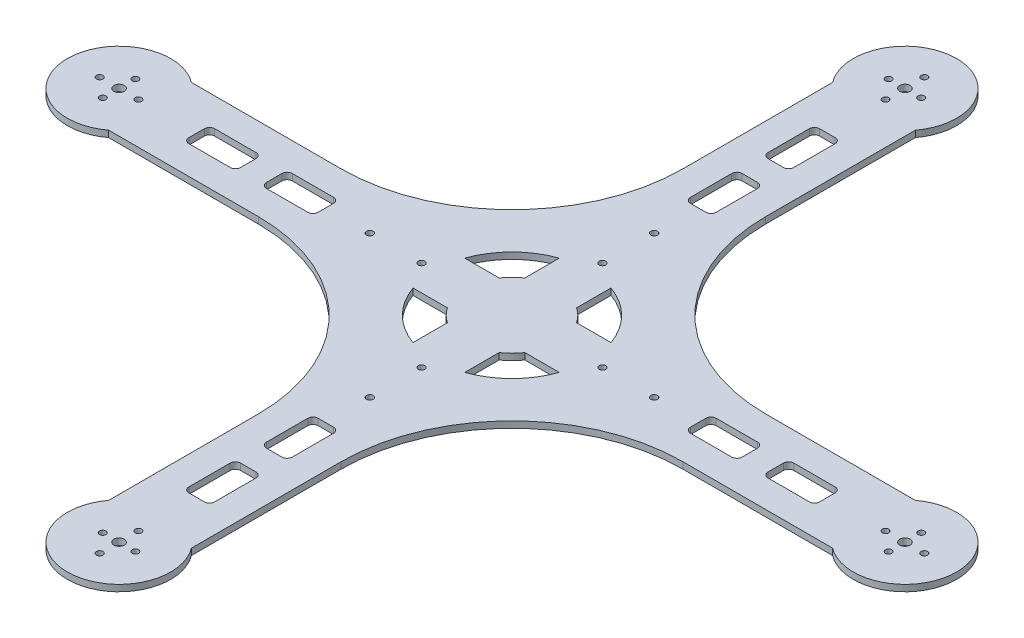
from build123d import *

# Parameters (mm, degrees)
SKETCH1_R           = 1.5875
SKETCH1_R_2         = 2.54
BOSS_EXTRUDE1_DEPTH = 3.175
CUT_EXTRUDE1_REACH  = 504.938
SKETCH5_R           = 1.651


with BuildPart() as part:
    # Sketch1 → Boss-Extrude1 (new body)
    with BuildSketch(Plane(origin=(0, 0, 0), x_dir=(1, 0, 0), z_dir=(0, 1, 0))):
        with BuildLine():
            Line((129.095821507, 17.784127356), (55.54156313, 17.784127356))
            ThreePointArc((55.54156313, 17.784127356), (14.90156313, -2.535872644), (55.54156313, -22.855872644))
            Line((55.54156313, -22.855872644), (129.095821507, -22.855872644))
            ThreePointArc((129.095821507, -22.855872644), (188.440282525, -47.437153249), (213.02156313, -106.781614267))
            Line((213.02156313, -106.781614267), (213.02156313, -180.335872644))
            ThreePointArc((213.02156313, -180.335872644), (233.34156313, -220.975872644), (253.66156313, -180.335872644))
            Line((253.66156313, -180.335872644), (253.66156313, -106.781614267))
            ThreePointArc((253.66156313, -106.781614267), (278.242843735, -47.437153249), (337.587304753, -22.855872644))
            Line((337.587304753, -22.855872644), (411.14156313, -22.855872644))
            ThreePointArc((411.14156313, -22.855872644), (451.78156313, -2.535872644), (411.14156313, 17.784127356))
            Line((411.14156313, 17.784127356), (337.587304753, 17.784127356))
            ThreePointArc((337.587304753, 17.784127356), (278.242843735, 42.365407962), (253.66156313, 101.70986898))
            Line((253.66156313, 101.70986898), (253.66156313, 175.264127356))
            ThreePointArc((253.66156313, 175.264127356), (233.34156313, 215.904127356), (213.02156313, 175.264127356))
            Line((213.02156313, 175.264127356), (213.02156313, 101.70986898))
            ThreePointArc((213.02156313, 101.70986898), (188.440282525, 42.365407962), (129.095821507, 17.784127356))
        make_face()
        with BuildLine():
            ThreePointArc((78.40156313, 1.274127356), (79.145511906, 3.07017858), (80.94156313, 3.814127356))
            Line((80.94156313, 3.814127356), (101.26156313, 3.814127356))
            ThreePointArc((101.26156313, 3.814127356), (103.057614354, 3.07017858), (103.80156313, 1.274127356))
            Line((103.80156313, 1.274127356), (103.80156313, -6.345872644))
            ThreePointArc((103.80156313, -6.345872644), (103.057614354, -8.141923868), (101.26156313, -8.885872644))
            Line((101.26156313, -8.885872644), (80.94156313, -8.885872644))
            ThreePointArc((80.94156313, -8.885872644), (79.145511906, -8.141923868), (78.40156313, -6.345872644))
            Line((78.40156313, -6.345872644), (78.40156313, 1.274127356))
        make_face(mode=Mode.SUBTRACT)
        with BuildLine():
            ThreePointArc((116.50156313, 1.274127356), (117.245511906, 3.07017858), (119.04156313, 3.814127356))
            Line((119.04156313, 3.814127356), (139.36156313, 3.814127356))
            ThreePointArc((139.36156313, 3.814127356), (141.157614354, 3.07017858), (141.90156313, 1.274127356))
            Line((141.90156313, 1.274127356), (141.90156313, -6.345872644))
            ThreePointArc((141.90156313, -6.345872644), (141.157614354, -8.141923868), (139.36156313, -8.885872644))
            Line((139.36156313, -8.885872644), (119.04156313, -8.885872644))
            ThreePointArc((119.04156313, -8.885872644), (117.245511906, -8.141923868), (116.50156313, -6.345872644))
            Line((116.50156313, -6.345872644), (116.50156313, 1.274127356))
        make_face(mode=Mode.SUBTRACT)
        with Locations((40.30156313, 5.464127356)):
            Circle(SKETCH1_R, mode=Mode.SUBTRACT)
        with Locations((49.80156313, -2.535872644)):
            Circle(SKETCH1_R, mode=Mode.SUBTRACT)
        with Locations((40.30156313, -10.535872644)):
            Circle(SKETCH1_R, mode=Mode.SUBTRACT)
        with Locations((30.80156313, -2.535872644)):
            Circle(SKETCH1_R, mode=Mode.SUBTRACT)
        with Locations((40.30156313, -2.535872644)):
            Circle(SKETCH1_R_2, mode=Mode.SUBTRACT)
        with BuildLine():
            ThreePointArc((220.64156313, -38.456897128), (206.400794767, -29.476641007), (197.420538646, -15.235872644))
            Line((197.420538646, -15.235872644), (214.333943605, -15.235872644))
            ThreePointArc((214.333943605, -15.235872644), (217.177102112, -18.700333662), (220.64156313, -21.543492169))
            Line((220.64156313, -21.543492169), (220.64156313, -38.456897128))
        make_face(mode=Mode.SUBTRACT)
        with BuildLine():
            ThreePointArc((269.262587614, -15.235872644), (260.282331493, -29.476641007), (246.04156313, -38.456897128))
            Line((246.04156313, -38.456897128), (246.04156313, -21.543492169))
            ThreePointArc((246.04156313, -21.543492169), (249.506024148, -18.700333662), (252.349182655, -15.235872644))
            Line((252.349182655, -15.235872644), (269.262587614, -15.235872644))
        make_face(mode=Mode.SUBTRACT)
        with BuildLine():
            ThreePointArc((246.04156313, 33.385151841), (260.282331493, 24.404895719), (269.262587614, 10.164127356))
            Line((269.262587614, 10.164127356), (252.349182655, 10.164127356))
            ThreePointArc((252.349182655, 10.164127356), (249.506024148, 13.628588374), (246.04156313, 16.471746881))
            Line((246.04156313, 16.471746881), (246.04156313, 33.385151841))
        make_face(mode=Mode.SUBTRACT)
        with BuildLine():
            ThreePointArc((197.420538646, 10.164127356), (206.400794767, 24.404895719), (220.64156313, 33.385151841))
            Line((220.64156313, 33.385151841), (220.64156313, 16.471746881))
            ThreePointArc((220.64156313, 16.471746881), (217.177102112, 13.628588374), (214.333943605, 10.164127356))
            Line((214.333943605, 10.164127356), (197.420538646, 10.164127356))
        make_face(mode=Mode.SUBTRACT)
        with BuildLine():
            Line((226.99156313, 129.544127356), (226.99156313, 149.864127356))
            ThreePointArc((226.99156313, 149.864127356), (227.735511906, 151.66017858), (229.53156313, 152.404127356))
            Line((229.53156313, 152.404127356), (237.15156313, 152.404127356))
            ThreePointArc((237.15156313, 152.404127356), (238.947614354, 151.66017858), (239.69156313, 149.864127356))
            Line((239.69156313, 149.864127356), (239.69156313, 129.544127356))
            ThreePointArc((239.69156313, 129.544127356), (238.947614354, 127.748076132), (237.15156313, 127.004127356))
            Line((237.15156313, 127.004127356), (229.53156313, 127.004127356))
            ThreePointArc((229.53156313, 127.004127356), (227.735511906, 127.748076132), (226.99156313, 129.544127356))
        make_face(mode=Mode.SUBTRACT)
        with BuildLine():
            ThreePointArc((226.99156313, 111.764127356), (227.735511906, 113.56017858), (229.53156313, 114.304127356))
            Line((229.53156313, 114.304127356), (237.15156313, 114.304127356))
            ThreePointArc((237.15156313, 114.304127356), (238.947614354, 113.56017858), (239.69156313, 111.764127356))
            Line((239.69156313, 111.764127356), (239.69156313, 91.444127356))
            ThreePointArc((239.69156313, 91.444127356), (238.947614354, 89.648076132), (237.15156313, 88.904127356))
            Line((237.15156313, 88.904127356), (229.53156313, 88.904127356))
            ThreePointArc((229.53156313, 88.904127356), (227.735511906, 89.648076132), (226.99156313, 91.444127356))
            Line((226.99156313, 91.444127356), (226.99156313, 111.764127356))
        make_face(mode=Mode.SUBTRACT)
        with BuildLine():
            ThreePointArc((365.42156313, -8.885872644), (363.625511906, -8.141923868), (362.88156313, -6.345872644))
            Line((362.88156313, -6.345872644), (362.88156313, 1.274127356))
            ThreePointArc((362.88156313, 1.274127356), (363.625511906, 3.07017858), (365.42156313, 3.814127356))
            Line((365.42156313, 3.814127356), (385.74156313, 3.814127356))
            ThreePointArc((385.74156313, 3.814127356), (387.537614354, 3.07017858), (388.28156313, 1.274127356))
            Line((388.28156313, 1.274127356), (388.28156313, -6.345872644))
            ThreePointArc((388.28156313, -6.345872644), (387.537614354, -8.141923868), (385.74156313, -8.885872644))
            Line((385.74156313, -8.885872644), (365.42156313, -8.885872644))
        make_face(mode=Mode.SUBTRACT)
        with BuildLine():
            ThreePointArc((350.18156313, -6.345872644), (349.437614354, -8.141923868), (347.64156313, -8.885872644))
            Line((347.64156313, -8.885872644), (327.32156313, -8.885872644))
            ThreePointArc((327.32156313, -8.885872644), (325.525511906, -8.141923868), (324.78156313, -6.345872644))
            Line((324.78156313, -6.345872644), (324.78156313, 1.274127356))
            ThreePointArc((324.78156313, 1.274127356), (325.525511906, 3.07017858), (327.32156313, 3.814127356))
            Line((327.32156313, 3.814127356), (347.64156313, 3.814127356))
            ThreePointArc((347.64156313, 3.814127356), (349.437614354, 3.07017858), (350.18156313, 1.274127356))
            Line((350.18156313, 1.274127356), (350.18156313, -6.345872644))
        make_face(mode=Mode.SUBTRACT)
        with BuildLine():
            Line((237.15156313, -119.375872644), (229.53156313, -119.375872644))
            ThreePointArc((229.53156313, -119.375872644), (227.735511906, -118.631923868), (226.99156313, -116.835872644))
            Line((226.99156313, -116.835872644), (226.99156313, -96.515872644))
            ThreePointArc((226.99156313, -96.515872644), (227.735511906, -94.71982142), (229.53156313, -93.975872644))
            Line((229.53156313, -93.975872644), (237.15156313, -93.975872644))
            ThreePointArc((237.15156313, -93.975872644), (238.947614354, -94.71982142), (239.69156313, -96.515872644))
            Line((239.69156313, -96.515872644), (239.69156313, -116.835872644))
            ThreePointArc((239.69156313, -116.835872644), (238.947614354, -118.631923868), (237.15156313, -119.375872644))
        make_face(mode=Mode.SUBTRACT)
        with BuildLine():
            Line((229.53156313, -132.075872644), (237.15156313, -132.075872644))
            ThreePointArc((237.15156313, -132.075872644), (238.947614354, -132.81982142), (239.69156313, -134.615872644))
            Line((239.69156313, -134.615872644), (239.69156313, -154.935872644))
            ThreePointArc((239.69156313, -154.935872644), (238.947614354, -156.731923868), (237.15156313, -157.475872644))
            Line((237.15156313, -157.475872644), (229.53156313, -157.475872644))
            ThreePointArc((229.53156313, -157.475872644), (227.735511906, -156.731923868), (226.99156313, -154.935872644))
            Line((226.99156313, -154.935872644), (226.99156313, -134.615872644))
            ThreePointArc((226.99156313, -134.615872644), (227.735511906, -132.81982142), (229.53156313, -132.075872644))
        make_face(mode=Mode.SUBTRACT)
        with Locations((241.34156313, 190.504127356)):
            Circle(SKETCH1_R, mode=Mode.SUBTRACT)
        with Locations((225.34156313, 190.504127356)):
            Circle(SKETCH1_R, mode=Mode.SUBTRACT)
        with Locations((233.34156313, 200.004127356)):
            Circle(SKETCH1_R, mode=Mode.SUBTRACT)
        with Locations((233.34156313, 181.004127356)):
            Circle(SKETCH1_R, mode=Mode.SUBTRACT)
        with Locations((233.34156313, 190.504127356)):
            Circle(SKETCH1_R_2, mode=Mode.SUBTRACT)
        with Locations((426.38156313, 5.464127356)):
            Circle(SKETCH1_R, mode=Mode.SUBTRACT)
        with Locations((426.38156313, -10.535872644)):
            Circle(SKETCH1_R, mode=Mode.SUBTRACT)
        with Locations((416.88156313, -2.535872644)):
            Circle(SKETCH1_R, mode=Mode.SUBTRACT)
        with Locations((426.38156313, -2.535872644)):
            Circle(SKETCH1_R_2, mode=Mode.SUBTRACT)
        with Locations((435.88156313, -2.535872644)):
            Circle(SKETCH1_R, mode=Mode.SUBTRACT)
        with Locations((233.34156313, -186.075872644)):
            Circle(SKETCH1_R, mode=Mode.SUBTRACT)
        with Locations((225.34156313, -195.575872644)):
            Circle(SKETCH1_R, mode=Mode.SUBTRACT)
        with Locations((233.34156313, -205.075872644)):
            Circle(SKETCH1_R, mode=Mode.SUBTRACT)
        with Locations((233.34156313, -195.575872644)):
            Circle(SKETCH1_R_2, mode=Mode.SUBTRACT)
        with Locations((241.34156313, -195.575872644)):
            Circle(SKETCH1_R, mode=Mode.SUBTRACT)
    extrude(amount=BOSS_EXTRUDE1_DEPTH)

    # Sketch5 → Cut-Extrude1 (cut, up to next)
    with BuildSketch(Plane.XZ, mode=Mode.PRIVATE) as cut_extrude1_sk1:
        with Locations((233.34156313, 46.985872644)):
            Circle(SKETCH5_R)
    cut_extrude1_tool1 = extrude(cut_extrude1_sk1.sketch, amount=-CUT_EXTRUDE1_REACH, mode=Mode.PRIVATE) & part.part
    # Sketch5 → Cut-Extrude1 (cut, up to next)
    with BuildSketch(Plane.XZ, mode=Mode.PRIVATE) as cut_extrude1_sk2:
        with Locations((233.34156313, 72.385872644)):
            Circle(SKETCH5_R)
    cut_extrude1_tool2 = extrude(cut_extrude1_sk2.sketch, amount=-CUT_EXTRUDE1_REACH, mode=Mode.PRIVATE) & part.part
    # Sketch5 → Cut-Extrude1 (cut, up to next)
    with BuildSketch(Plane.XZ, mode=Mode.PRIVATE) as cut_extrude1_sk3:
        with Locations((277.79156313, 2.535872644)):
            Circle(SKETCH5_R)
    cut_extrude1_tool3 = extrude(cut_extrude1_sk3.sketch, amount=-CUT_EXTRUDE1_REACH, mode=Mode.PRIVATE) & part.part
    # Sketch5 → Cut-Extrude1 (cut, up to next)
    with BuildSketch(Plane.XZ, mode=Mode.PRIVATE) as cut_extrude1_sk4:
        with Locations((303.19156313, 2.535872644)):
            Circle(SKETCH5_R)
    cut_extrude1_tool4 = extrude(cut_extrude1_sk4.sketch, amount=-CUT_EXTRUDE1_REACH, mode=Mode.PRIVATE) & part.part
    # Sketch5 → Cut-Extrude1 (cut, up to next)
    with BuildSketch(Plane.XZ, mode=Mode.PRIVATE) as cut_extrude1_sk5:
        with Locations((233.34156313, -41.914127356)):
            Circle(SKETCH5_R)
    cut_extrude1_tool5 = extrude(cut_extrude1_sk5.sketch, amount=-CUT_EXTRUDE1_REACH, mode=Mode.PRIVATE) & part.part
    # Sketch5 → Cut-Extrude1 (cut, up to next)
    with BuildSketch(Plane.XZ, mode=Mode.PRIVATE) as cut_extrude1_sk6:
        with Locations((233.34156313, -67.314127356)):
            Circle(SKETCH5_R)
    cut_extrude1_tool6 = extrude(cut_extrude1_sk6.sketch, amount=-CUT_EXTRUDE1_REACH, mode=Mode.PRIVATE) & part.part
    # Sketch5 → Cut-Extrude1 (cut, up to next)
    with BuildSketch(Plane.XZ, mode=Mode.PRIVATE) as cut_extrude1_sk7:
        with Locations((163.49156313, 2.535872644)):
            Circle(SKETCH5_R)
    cut_extrude1_tool7 = extrude(cut_extrude1_sk7.sketch, amount=-CUT_EXTRUDE1_REACH, mode=Mode.PRIVATE) & part.part
    # Sketch5 → Cut-Extrude1 (cut, up to next)
    with BuildSketch(Plane.XZ, mode=Mode.PRIVATE) as cut_extrude1_sk8:
        with Locations((188.89156313, 2.535872644)):
            Circle(SKETCH5_R)
    cut_extrude1_tool8 = extrude(cut_extrude1_sk8.sketch, amount=-CUT_EXTRUDE1_REACH, mode=Mode.PRIVATE) & part.part
    add(cut_extrude1_tool1.solids().sort_by_distance((233.341563, 0, 46.985873))[0], mode=Mode.SUBTRACT)
    add(cut_extrude1_tool2.solids().sort_by_distance((233.341563, 0, 72.385873))[0], mode=Mode.SUBTRACT)
    add(cut_extrude1_tool3.solids().sort_by_distance((277.791563, 0, 2.535873))[0], mode=Mode.SUBTRACT)
    add(cut_extrude1_tool4.solids().sort_by_distance((303.191563, 0, 2.535873))[0], mode=Mode.SUBTRACT)
    add(cut_extrude1_tool5.solids().sort_by_distance((233.341563, 0, -41.914127))[0], mode=Mode.SUBTRACT)
    add(cut_extrude1_tool6.solids().sort_by_distance((233.341563, 0, -67.314127))[0], mode=Mode.SUBTRACT)
    add(cut_extrude1_tool7.solids().sort_by_distance((163.491563, 0, 2.535873))[0], mode=Mode.SUBTRACT)
    add(cut_extrude1_tool8.solids().sort_by_distance((188.891563, 0, 2.535873))[0], mode=Mode.SUBTRACT)


solid = part.part
